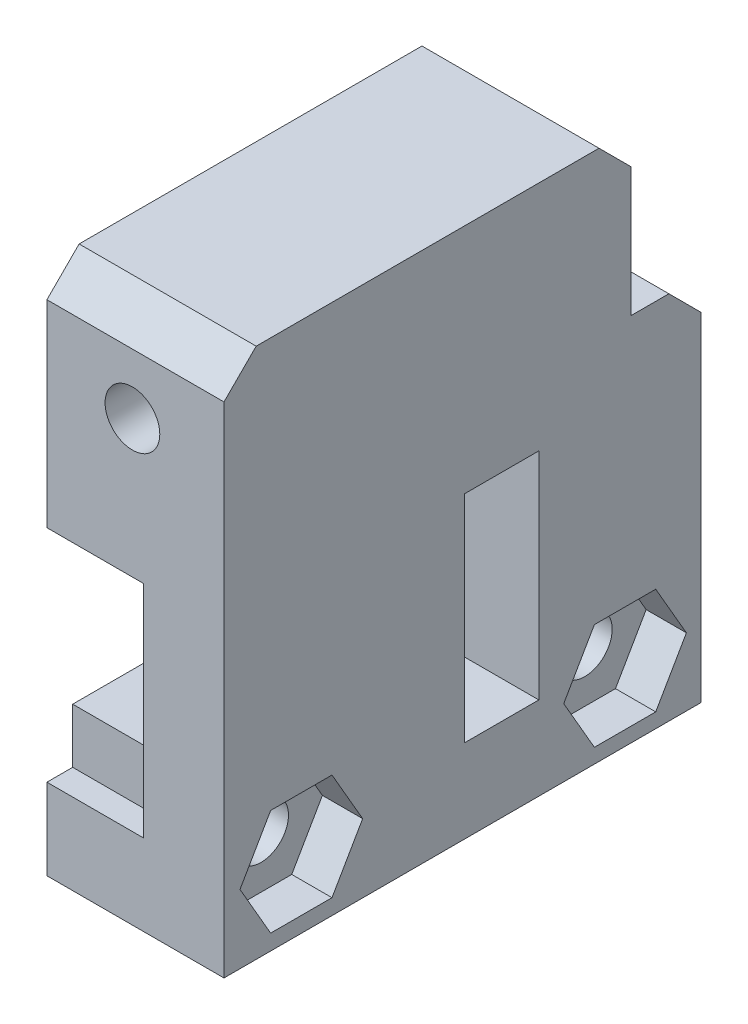
from build123d import *

# Parameters (mm, degrees)
SKETCH1_W           = 29.64084851
SKETCH1_H           = 22.995210284
BOSS_EXTRUDE1_DEPTH = 11
SKETCH2_W           = 11
SKETCH2_H           = 25.30011898
BOSS_EXTRUDE2_DEPTH = 10
CHAMFER1_SIZE       = 2
SKETCH3_W           = 31.444464136
SKETCH3_H           = 13.690550156
CUT_EXTRUDE2_DEPTH  = 6
SKETCH4_W           = 16.801230495
SKETCH4_H           = 6.210132239
BOSS_EXTRUDE3_DEPTH = 7
SKETCH5_R           = 2.040999549
CUT_EXTRUDE3_DEPTH  = 33.013106791
SKETCH6_W           = 4.621469737
SKETCH6_H           = 13.3986797
CUT_EXTRUDE4_DEPTH  = 29.73659691
SKETCH7_R           = 1.7
CUT_EXTRUDE5_DEPTH  = 27
SKETCH21_W          = 6.4100694
SKETCH21_H          = 8.3354859
BOSS_EXTRUDE4_DEPTH = 11
SKETCH20_W          = 6.410069378
SKETCH20_H          = 8.335485858
BOSS_EXTRUDE5_DEPTH = 11
CUT_EXTRUDE6_DEPTH  = 2.5
SKETCH19_R          = 1.7
CUT_EXTRUDE7_DEPTH  = 29.73659691
CUT_EXTRUDE8_DEPTH  = 2.5
SKETCH18_R          = 1.7
CUT_EXTRUDE9_DEPTH  = 29.73659691


with BuildPart() as part:
    # Sketch1 → Boss-Extrude1 (new body)
    with BuildSketch(Plane(origin=(0, 0, 0), x_dir=(0, 0, -1), z_dir=(1, 0, 0))):
        Rectangle(SKETCH1_W, SKETCH1_H)
    extrude(amount=BOSS_EXTRUDE1_DEPTH)

    # Sketch2 → Boss-Extrude2 (add)
    with BuildSketch(Plane(origin=(0, 11.497605142, 0), x_dir=(1, 0, 0), z_dir=(0, 1, 0))):
        with Locations((5.5, -2.170364765)):
            Rectangle(SKETCH2_W, SKETCH2_H)
    extrude(amount=BOSS_EXTRUDE2_DEPTH)

    # Chamfer1
    chamfer1_edges = [part.edges().sort_by_distance(p)[0] for p in [
        (5.5, 11.497605142, -14.820424255),
        (5.5, 21.497605142, -10.479694725),
        (5.5, 21.497605142, 14.820424255),
    ]]
    chamfer(chamfer1_edges, length=CHAMFER1_SIZE)

    # Sketch3 → Cut-Extrude2 (cut)
    with BuildSketch(Plane.ZY):
        with Locations((0.26445091, 0.38357275)):
            Rectangle(SKETCH3_W, SKETCH3_H)
    extrude(amount=-CUT_EXTRUDE2_DEPTH, mode=Mode.SUBTRACT)

    # Sketch4 → Boss-Extrude3 (add)
    with BuildSketch(Plane(origin=(6, 0.435062227, 0), x_dir=(0, 0, 1), z_dir=(-1, 0, 0))):
        with Locations((-2.204570257, -0.002306757)):
            Rectangle(SKETCH4_W, SKETCH4_H)
    extrude(amount=BOSS_EXTRUDE3_DEPTH)

    # Sketch5 → Cut-Extrude3 (cut, through all)
    with BuildSketch(Plane.XY.offset(6.196044991)):
        with Locations((2.19753076, 0.369675098)):
            Circle(SKETCH5_R)
    extrude(amount=-CUT_EXTRUDE3_DEPTH, mode=Mode.SUBTRACT)

    # Sketch6 → Cut-Extrude4 (cut, through all)
    with BuildSketch(Plane(origin=(11, 0, 0), x_dir=(0, 0, -1), z_dir=(1, 0, 0))):
        with Locations((2.429578273, 0.383063563)):
            Rectangle(SKETCH6_W, SKETCH6_H)
    extrude(amount=-CUT_EXTRUDE4_DEPTH, mode=Mode.SUBTRACT)

    # Sketch7 → Cut-Extrude5 (cut)
    with BuildSketch(Plane.XY.offset(14.820424255)):
        with Locations((5.312142967, 15.762432364)):
            Circle(SKETCH7_R)
    extrude(amount=-CUT_EXTRUDE5_DEPTH, mode=Mode.SUBTRACT)

    # Sketch21 → Boss-Extrude4 (add)
    with BuildSketch(Plane(origin=(11, 0, 0), x_dir=(0, 0, -1), z_dir=(1, 0, 0))):
        with Locations((10.097369078, -7.290376311)):
            Rectangle(SKETCH21_W, SKETCH21_H)
    extrude(amount=-BOSS_EXTRUDE4_DEPTH)

    # Sketch20 → Boss-Extrude5 (add)
    with BuildSketch(Plane(origin=(11, 0, 0), x_dir=(0, 0, -1), z_dir=(1, 0, 0))):
        with Locations((-10.015073396, -7.232029734)):
            Rectangle(SKETCH20_W, SKETCH20_H)
    extrude(amount=-BOSS_EXTRUDE5_DEPTH)

    # Sketch15 → Cut-Extrude6 (cut)
    with BuildSketch(Plane(origin=(11, 0, 0), x_dir=(0, 0, -1), z_dir=(1, 0, 0))):
        Polygon((-8.109817508, -10.532029734), (-6.204561619, -7.232029734), (-8.109817508, -3.932029734), (-11.920329284, -3.932029734), (-13.825585173, -7.232029734), (-11.920329284, -10.532029734), align=None)
    extrude(amount=-CUT_EXTRUDE6_DEPTH, mode=Mode.SUBTRACT)

    # Sketch19 → Cut-Extrude7 (cut, through all)
    with BuildSketch(Plane(origin=(11, 0, 0), x_dir=(0, 0, -1), z_dir=(1, 0, 0))):
        with Locations((-10.015073396, -7.232029734)):
            Circle(SKETCH19_R)
    extrude(amount=-CUT_EXTRUDE7_DEPTH, mode=Mode.SUBTRACT)

    # Sketch17 → Cut-Extrude8 (cut)
    with BuildSketch(Plane(origin=(11, 0, 0), x_dir=(0, 0, -1), z_dir=(1, 0, 0))):
        Polygon((12.002624966, -10.590376311), (13.907880854, -7.290376311), (12.002624966, -3.990376311), (8.192113189, -3.990376311), (6.286857301, -7.290376311), (8.192113189, -10.590376311), align=None)
    extrude(amount=-CUT_EXTRUDE8_DEPTH, mode=Mode.SUBTRACT)

    # Sketch18 → Cut-Extrude9 (cut, through all)
    with BuildSketch(Plane(origin=(11, 0, 0), x_dir=(0, 0, -1), z_dir=(1, 0, 0))):
        with Locations((10.097369078, -7.290376311)):
            Circle(SKETCH18_R)
    extrude(amount=-CUT_EXTRUDE9_DEPTH, mode=Mode.SUBTRACT)


solid = part.part
